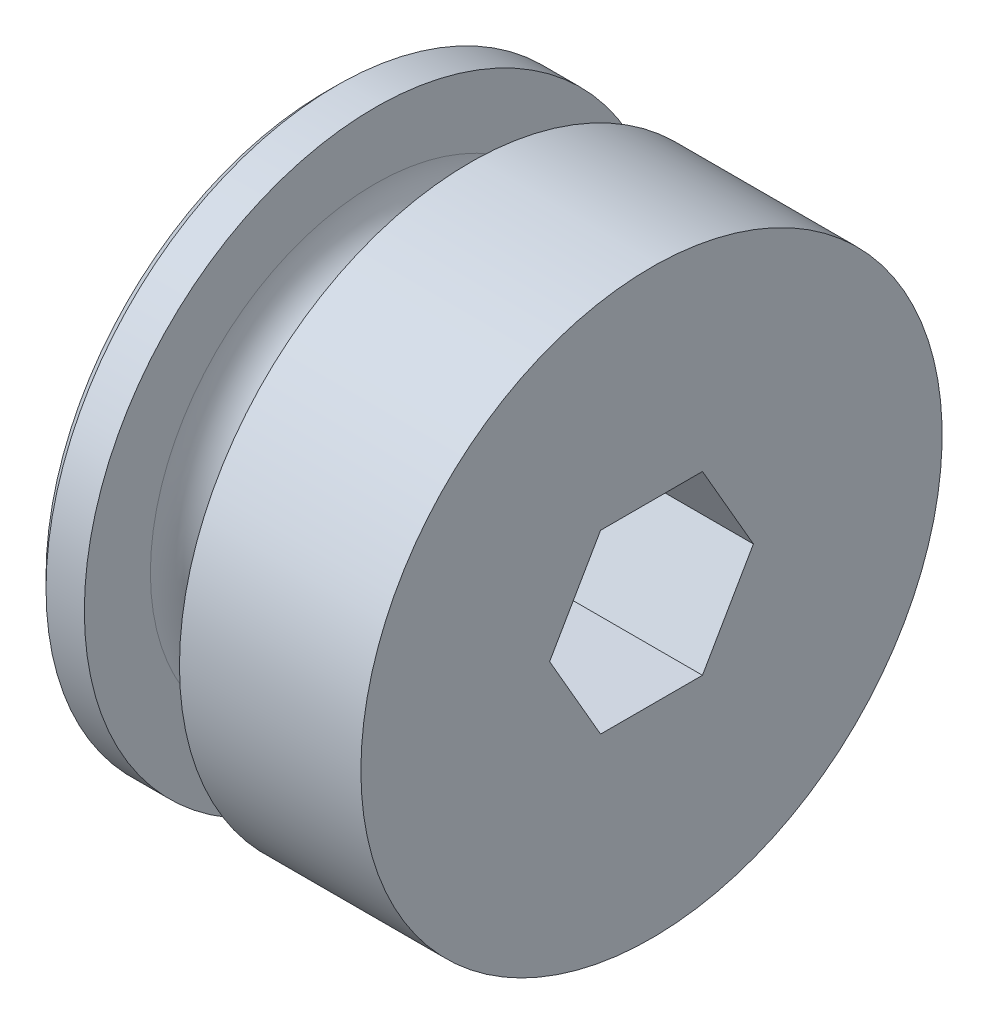
from build123d import *

# Parameters (mm, degrees)
CHAMFER1_SIZE      = 0.79375
CUT_EXTRUDE1_DEPTH = 38.818501755


with BuildPart() as part:
    # Sketch1 → Revolve1 (revolve)
    with BuildSketch(Plane.XY):
        with BuildLine():
            Line((0, 0), (23.495, 0))
            Line((23.495, 0), (23.495, 20.955))
            Line((23.495, 20.955), (10.414, 20.955))
            Line((10.414, 20.955), (10.414, 16.1925))
            ThreePointArc((10.414, 16.1925), (6.985, 12.7635), (3.556, 16.1925))
            Line((3.556, 16.1925), (3.556, 20.955))
            Line((3.556, 20.955), (0, 20.955))
            Line((0, 20.955), (0, 0))
        make_face()
    revolve(axis=Axis((0, 0, 0), (1, 0, 0)))

    # Chamfer1
    chamfer1_edges = [part.edges().sort_by_distance(p)[0] for p in [
        (0, -20.955, 0),
    ]]
    chamfer(chamfer1_edges, length=CHAMFER1_SIZE)

    # Sketch2 → Cut-Extrude1 (cut, through all)
    with BuildSketch(Plane.ZY):
        Polygon((3.673506558, -6.3627), (7.347013116, 0), (3.673506558, 6.3627), (-3.673506558, 6.3627), (-7.347013116, 0), (-3.673506558, -6.3627), align=None)
    extrude(amount=-CUT_EXTRUDE1_DEPTH, mode=Mode.SUBTRACT)


solid = part.part
